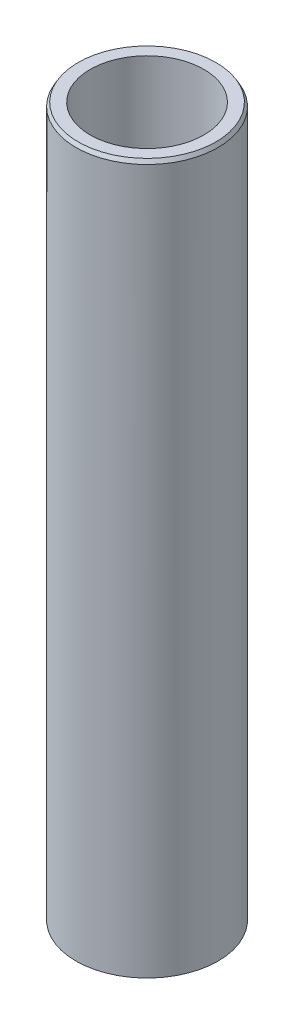
from build123d import *
from OCP.BRepFilletAPI import BRepFilletAPI_MakeChamfer

# Parameters (mm, degrees)
SKETCH1_R           = 60
BOSS_EXTRUDE1_DEPTH = 600
SKETCH2_R           = 48.027735615
CUT_EXTRUDE1_DEPTH  = 606.970296302
CHAMFER1_SIZE       = 3.19643806
CHAMFER1_SIZE2      = 1.845464374


with BuildPart() as part:
    # Sketch1 → Boss-Extrude1 (new body)
    with BuildSketch(Plane(origin=(0, 0, 0), x_dir=(1, 0, 0), z_dir=(0, 1, 0))):
        Circle(SKETCH1_R)
    extrude(amount=BOSS_EXTRUDE1_DEPTH)

    # Sketch2 → Cut-Extrude1 (cut, through all)
    with BuildSketch(Plane(origin=(0, 0, 0), x_dir=(1, 0, 0), z_dir=(0, 1, 0))):
        Circle(SKETCH2_R)
    extrude(amount=CUT_EXTRUDE1_DEPTH, mode=Mode.SUBTRACT)

    # Chamfer1: one chamfer whose edges measure the first distance from different faces: ONE call of the kernel's chamfer builder (chamfer() names one face for all edges)
    chamfer1_edges_1 = [part.edges().sort_by_distance(p)[0] for p in [
        (-60, 600, 0),
    ]]
    chamfer1_side_1 = [part.faces().sort_by_distance(p)[0] for p in [
        (-60, 300, 0),
    ]]
    chamfer1_edges_2 = [part.edges().sort_by_distance(p)[0] for p in [
        (-60, 0, 0),
    ]]
    chamfer1_side_2 = [part.faces().sort_by_distance(p)[0] for p in [
        (-58.302943725, 0, 0),
    ]]
    chamfer1 = BRepFilletAPI_MakeChamfer(part.part.solid().wrapped)
    for e in chamfer1_edges_1:
        chamfer1.Add(CHAMFER1_SIZE, CHAMFER1_SIZE2, e.wrapped, chamfer1_side_1[0].wrapped)  # the first distance lies on this face
    for e in chamfer1_edges_2:
        chamfer1.Add(CHAMFER1_SIZE, CHAMFER1_SIZE2, e.wrapped, chamfer1_side_2[0].wrapped)  # the first distance lies on this face
    add(Compound.cast(chamfer1.Shape()), mode=Mode.REPLACE)


solid = part.part
